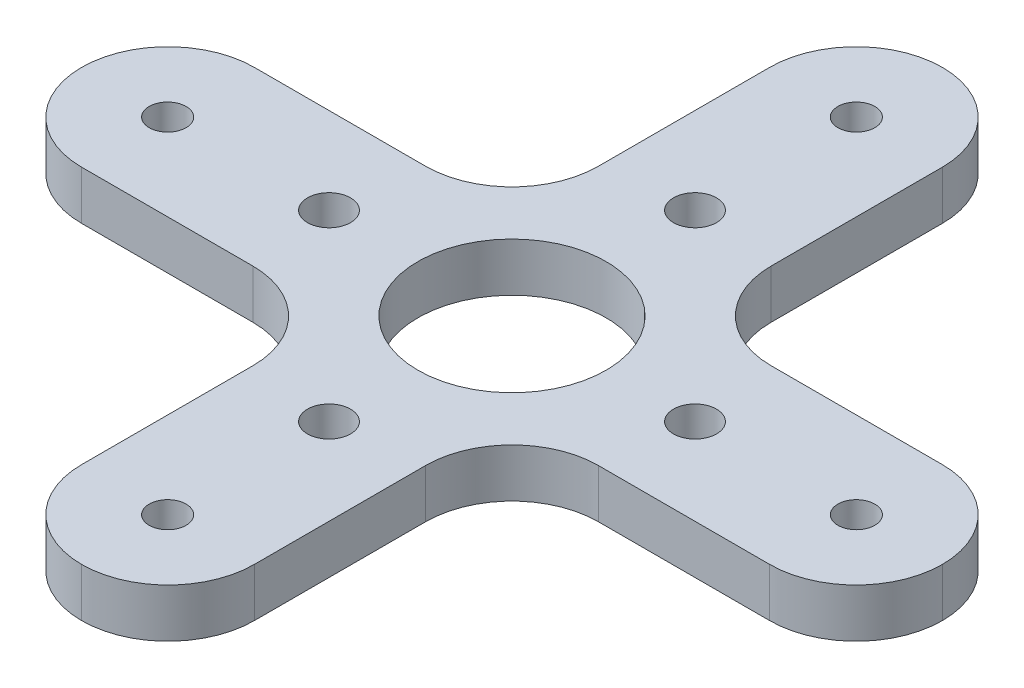
from build123d import *

# Parameters (mm, degrees)
BOSS_EXTRUDE1_DEPTH = 3.96
SKETCH3_R           = 7.655
SKETCH3_R_2         = 1.75
SKETCH3_R_3         = 1.5
CUT_EXTRUDE1_DEPTH  = 50.655630094
FILLET2_R           = 7.025


with BuildPart() as part:
    # Sketch1 → Boss-Extrude1 (new body)
    with BuildSketch(Plane(origin=(0, 0, 0), x_dir=(1, 0, 0), z_dir=(0, 1, 0))):
        Polygon((35, 7.025), (7.025, 7.025), (7.025, 35), (-7.025, 35), (-7.025, 7.025), (-35, 7.025), (-35, -7.025), (-7.025, -7.025), (-7.025, -35), (7.025, -35), (7.025, -7.025), (35, -7.025), align=None)
    extrude(amount=BOSS_EXTRUDE1_DEPTH)

    # Sketch3 → Cut-Extrude1 (cut, through all)
    with BuildSketch(Plane(origin=(0, 0, 0), x_dir=(1, 0, 0), z_dir=(0, 1, 0))):
        with Locations(Location((0, 0, 0), (0, 0, 270))):
            Circle(SKETCH3_R)
        with Locations(Location((-14.88, 0, 0), (0, 0, 270))):
            Circle(SKETCH3_R_2)
        with Locations(Location((-28, 0, 0), (0, 0, 270))):
            Circle(SKETCH3_R_3)
        with Locations(Location((28, 0, 0), (0, 0, 90))):
            Circle(SKETCH3_R_3)
        with Locations(Location((14.88, 0, 0), (0, 0, 90))):
            Circle(SKETCH3_R_2)
        with Locations(Location((0, 14.88, 0), (0, 0, 270))):
            Circle(SKETCH3_R_2)
        with Locations(Location((0, 28, 0), (0, 0, 270))):
            Circle(SKETCH3_R_3)
        with Locations(Location((0, -28, 0), (0, 0, 90))):
            Circle(SKETCH3_R_3)
        with Locations(Location((0, -14.88, 0), (0, 0, 90))):
            Circle(SKETCH3_R_2)
    extrude(amount=CUT_EXTRUDE1_DEPTH, mode=Mode.SUBTRACT)

    # Fillet2
    fillet2_edges = [part.edges().sort_by_distance(p)[0] for p in [
        (7.025, 1.98, 7.025),
        (7.025, 1.98, -7.025),
        (-7.025, 1.98, -7.025),
        (-7.025, 1.98, 7.025),
        (35, 1.98, -7.025),
        (35, 1.98, 7.025),
        (7.025, 1.98, 35),
        (-7.025, 1.98, 35),
        (-35, 1.98, 7.025),
        (-35, 1.98, -7.025),
        (7.025, 1.98, -35),
        (-7.025, 1.98, -35),
    ]]
    fillet(fillet2_edges, radius=FILLET2_R - 0.0001)  # a hair under: the kernel refuses the full size


solid = part.part
